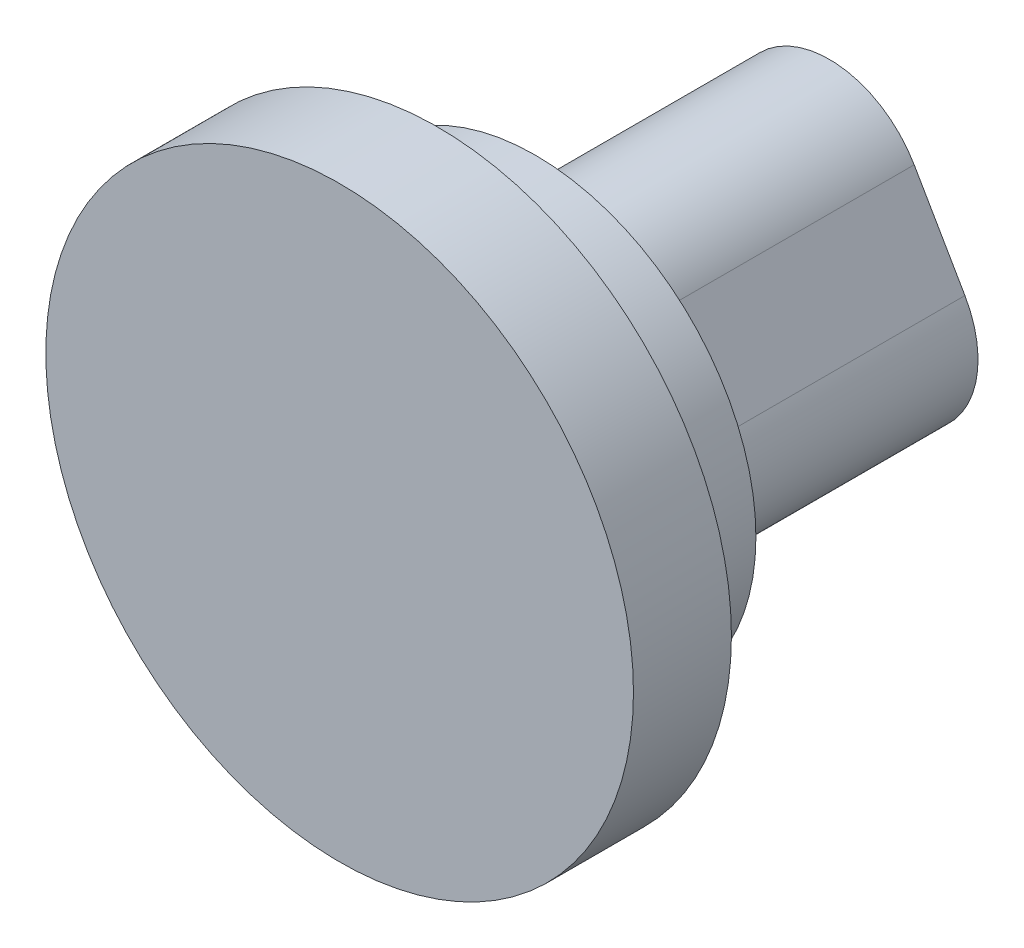
from build123d import *

# Parameters (mm, degrees)
EXTRUDE_1_DEPTH = 3
SKETCH_2_R      = 2.25
EXTRUDE_2_DEPTH = 1
SKETCH_3_R      = 3
EXTRUDE_3_DEPTH = 1
FILLET_1_R      = 1


with BuildPart() as part:
    # 草图1 → 凸台-拉伸1 (new body)
    with BuildSketch(Plane.XY):
        Polygon((0, 0), (4.5, 0), (2.25, 3.897114317), align=None)
    extrude(amount=EXTRUDE_1_DEPTH)

    # 草图2 → 凸台-拉伸2 (add)
    with BuildSketch(Plane.XY.offset(3)):
        with Locations(Location((2.25, 1.299038106, 0), (0, 0, 204.735610317))):
            Circle(SKETCH_2_R)
    extrude(amount=EXTRUDE_2_DEPTH)

    # 草图3 → 凸台-拉伸3 (add)
    with BuildSketch(Plane.XY.offset(4)):
        with Locations((2.25, 1.299038106)):
            Circle(SKETCH_3_R)
    extrude(amount=EXTRUDE_3_DEPTH)

    # 圆角1
    # the kernel refuses this fillet: 1 mm, written as the material it takes off along each edge
    with BuildSketch(Plane(origin=(2.25, 3.897114317, -4.330127019), x_dir=(-0.4999999999999997, -0.8660254037844388, 0), z_dir=(0, 0, 1))) as fillet_1_piece_1:
        with BuildLine():
            CenterArc((FILLET_1_R * 1.73205080757, FILLET_1_R), FILLET_1_R, 150, 120)
            Line((FILLET_1_R * 0.866025403784, FILLET_1_R * 1.5), (0, 0))
            Line((0, 0), (FILLET_1_R * 1.73205080757, 0))
        make_face()
    extrude(amount=7.330127019, mode=Mode.SUBTRACT)
    with BuildSketch(Plane(origin=(4.5, 0, -4.330127019), x_dir=(-1, 0, 0), z_dir=(0, 0, 1)), Plane(origin=(0, 0, -4.330127019), x_dir=(0.49999999999999983, 0.8660254037844387, 0), z_dir=(0, 0, 1))) as fillet_1_piece_2:
        with BuildLine():
            CenterArc((FILLET_1_R * 1.73205080757, -FILLET_1_R), FILLET_1_R, 90, 120)
            Line((FILLET_1_R * 0.866025403784, -FILLET_1_R * 1.5), (0, 0))
            Line((0, 0), (FILLET_1_R * 1.73205080757, 0))
        make_face()
    extrude(amount=7.330127019, mode=Mode.SUBTRACT)


solid = part.part
